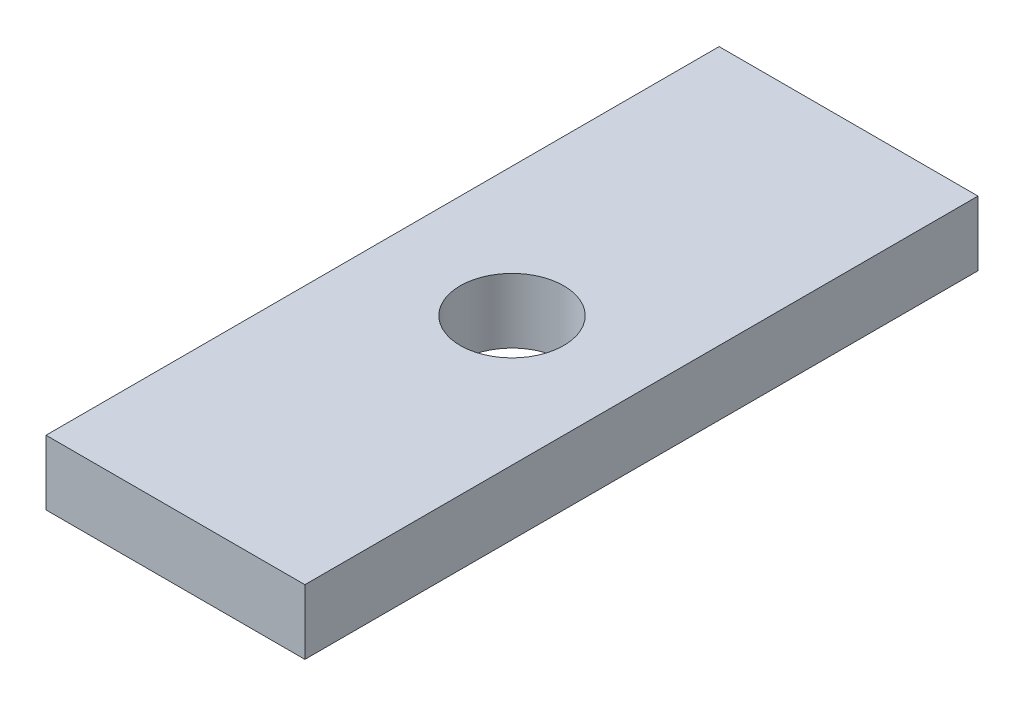
from build123d import *

# Parameters (mm, degrees)
SKETCH1_W                       = 20
SKETCH1_H                       = 5
BOSS_EXTRUDE1_DEPTH             = 106
SKETCH2_R                       = 4
HOLES_FOR_20MM_STRIP_ONLY_DEPTH = 107.587991819
SKETCH4_OUTSIDE_W               = 64.6
SKETCH4_OUTSIDE_H               = 256.6
SKETCH4_OUTSIDE_W_2             = 20
SKETCH4_OUTSIDE_H_2             = 52
CUT_EXTRUDE2_DEPTH              = 107.587991819


with BuildPart() as part:
    # Sketch1 → Boss-Extrude1 (new, symmetric)
    with BuildSketch(Plane.XY):
        Rectangle(SKETCH1_W, SKETCH1_H)
    extrude(amount=BOSS_EXTRUDE1_DEPTH, both=True)

    # Sketch2 → Holes for 20mm strip ONLY (cut, through all)
    with BuildSketch(Plane(origin=(0, 2.5, 0), x_dir=(1, 0, 0), z_dir=(0, 1, 0))):
        with Locations((0, 87.5)):
            Circle(SKETCH2_R)
        Circle(SKETCH2_R)
        with Locations((0, -87.5)):
            Circle(SKETCH2_R)
    extrude(amount=-HOLES_FOR_20MM_STRIP_ONLY_DEPTH, mode=Mode.SUBTRACT)

    # Sketch4 outside → Cut-Extrude2 (cut, through all)
    with BuildSketch(Plane(origin=(0, 2.5, 0), x_dir=(1, 0, 0), z_dir=(0, 1, 0))):
        Rectangle(SKETCH4_OUTSIDE_W, SKETCH4_OUTSIDE_H)
        Rectangle(SKETCH4_OUTSIDE_W_2, SKETCH4_OUTSIDE_H_2, mode=Mode.SUBTRACT)
    extrude(amount=-CUT_EXTRUDE2_DEPTH, mode=Mode.SUBTRACT)


solid = part.part
